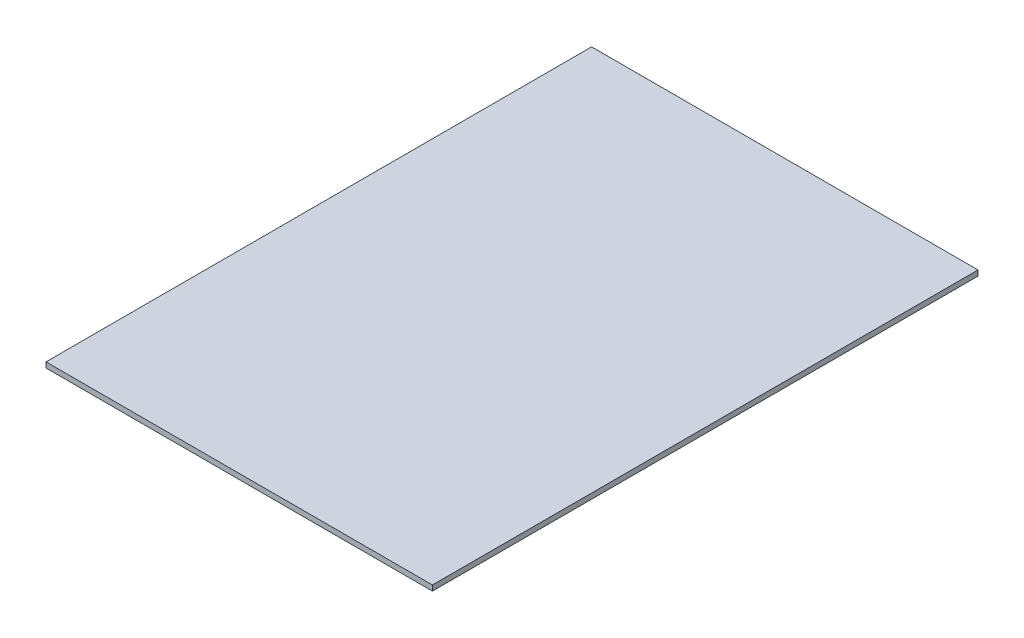
from build123d import *

# Parameters (mm, degrees)
CROQUIS1_W              = 216
CROQUIS1_H              = 310
SALIENTE_EXTRUIR1_DEPTH = 3
CROQUIS2_W              = 216
CROQUIS2_H              = 2.5
CORTAR_EXTRUIR1_DEPTH   = 4


with BuildPart() as part:
    # Croquis1 → Saliente-Extruir1 (new body)
    with BuildSketch(Plane(origin=(0, 0, 0), x_dir=(1, 0, 0), z_dir=(0, 1, 0))):
        Rectangle(CROQUIS1_W, CROQUIS1_H)
    extrude(amount=SALIENTE_EXTRUIR1_DEPTH)

    # Croquis2 → Cortar-Extruir1 (cut)
    with BuildSketch(Plane(origin=(0, 3, 0), x_dir=(1, 0, 0), z_dir=(0, 1, 0))):
        with Locations((0, 153.75)):
            Rectangle(CROQUIS2_W, CROQUIS2_H)
        with Locations((0, -153.75)):
            Rectangle(CROQUIS2_W, CROQUIS2_H)
    extrude(amount=-CORTAR_EXTRUIR1_DEPTH, mode=Mode.SUBTRACT)


solid = part.part
